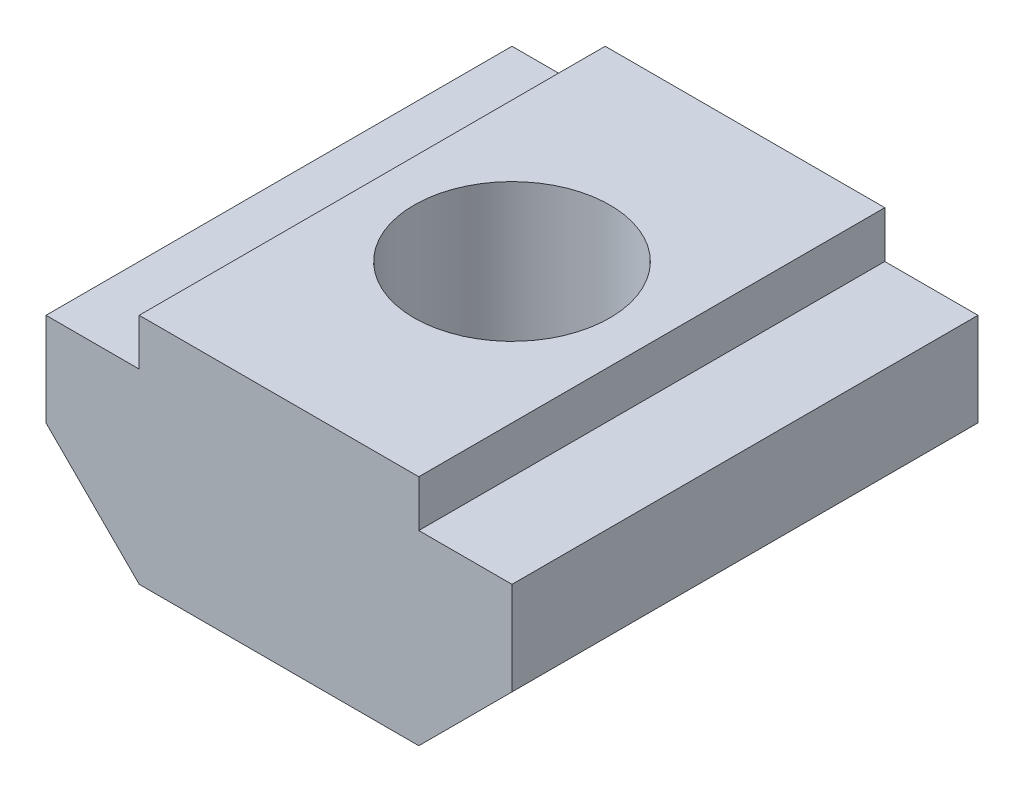
from build123d import *

# Parameters (mm, degrees)
BOSS_EXTRUDE1_DEPTH = 5
SKETCH2_R           = 2.1
CUT_EXTRUDE1_DEPTH  = 9.660254038


with BuildPart() as part:
    # Sketch1 → Boss-Extrude1 (new, symmetric)
    with BuildSketch(Plane.XY):
        Polygon((-5, 1.5), (-5, -0.5), (-3, -2.5), (3, -2.5), (5, -0.5), (5, 1.5), (3, 1.5), (3, 2.5), (-3, 2.5), (-3, 1.5), align=None)
    extrude(amount=BOSS_EXTRUDE1_DEPTH, both=True)

    # Sketch2 → Cut-Extrude1 (cut, through all)
    with BuildSketch(Plane(origin=(0, 2.5, 0), x_dir=(1, 0, 0), z_dir=(0, 1, 0))):
        Circle(SKETCH2_R)
    extrude(amount=-CUT_EXTRUDE1_DEPTH, mode=Mode.SUBTRACT)


solid = part.part
